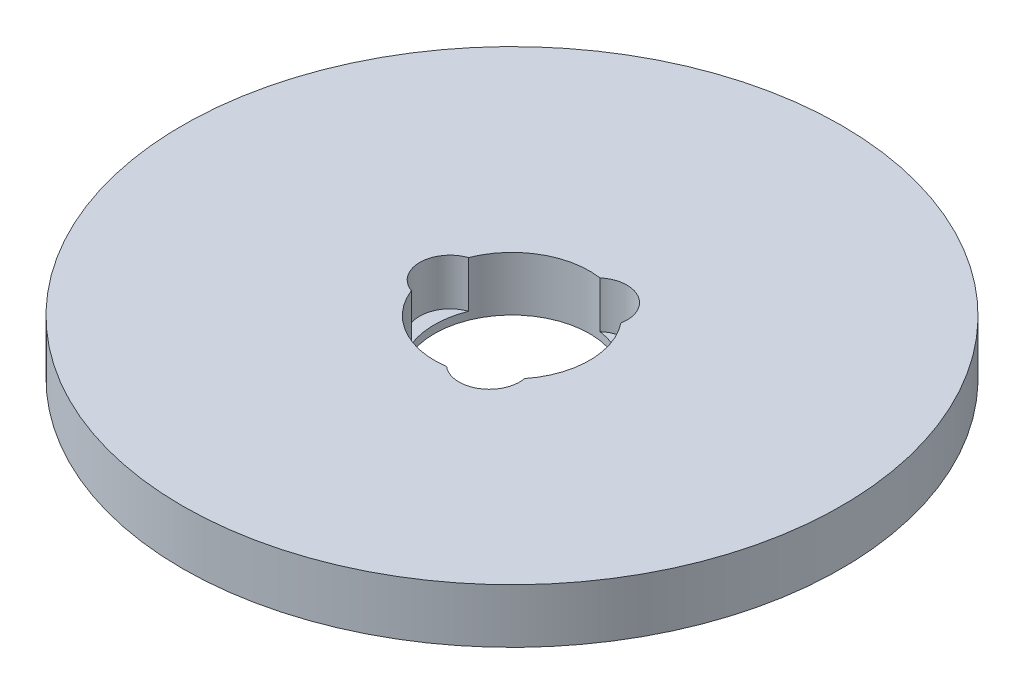
from build123d import *

# Parameters (mm, degrees)
SKETCH1_R           = 42.5
BOSS_EXTRUDE1_DEPTH = 7
SKETCH2_R           = 10
CUT_EXTRUDE1_DEPTH  = 61.510329697
SKETCH3_R           = 3.911497786
CUT_EXTRUDE2_DEPTH  = 6.001016356
CIRPATTERN1_COUNT   = 3


with BuildPart() as part:
    # Sketch1 → Boss-Extrude1 (new body)
    with BuildSketch(Plane(origin=(0, 0, 0), x_dir=(1, 0, 0), z_dir=(0, 1, 0))):
        Circle(SKETCH1_R)
    extrude(amount=BOSS_EXTRUDE1_DEPTH)

    # Sketch2 → Cut-Extrude1 (cut, through all)
    with BuildSketch(Plane(origin=(0, 0, 0), x_dir=(1, 0, 0), z_dir=(0, 1, 0))):
        Circle(SKETCH2_R)
    extrude(amount=CUT_EXTRUDE1_DEPTH, mode=Mode.SUBTRACT)

    # Sketch3 → Cut-Extrude2 (cut)
    with BuildSketch(Plane(origin=(0, 7, 0), x_dir=(1, 0, 0), z_dir=(0, 1, 0))):
        with Locations((-7.988732022, 0)):
            Circle(SKETCH3_R)
    cut_extrude2 = extrude(amount=-CUT_EXTRUDE2_DEPTH, mode=Mode.SUBTRACT)

    # CirPattern1: Cut-Extrude2 ×3 about axis
    cirpattern1_axis = Axis((0, 0, 0), (0, 1, 0))
    for i in range(1, CIRPATTERN1_COUNT):
        add(cut_extrude2.rotate(cirpattern1_axis, i * 360 / CIRPATTERN1_COUNT), mode=Mode.SUBTRACT)


solid = part.part
